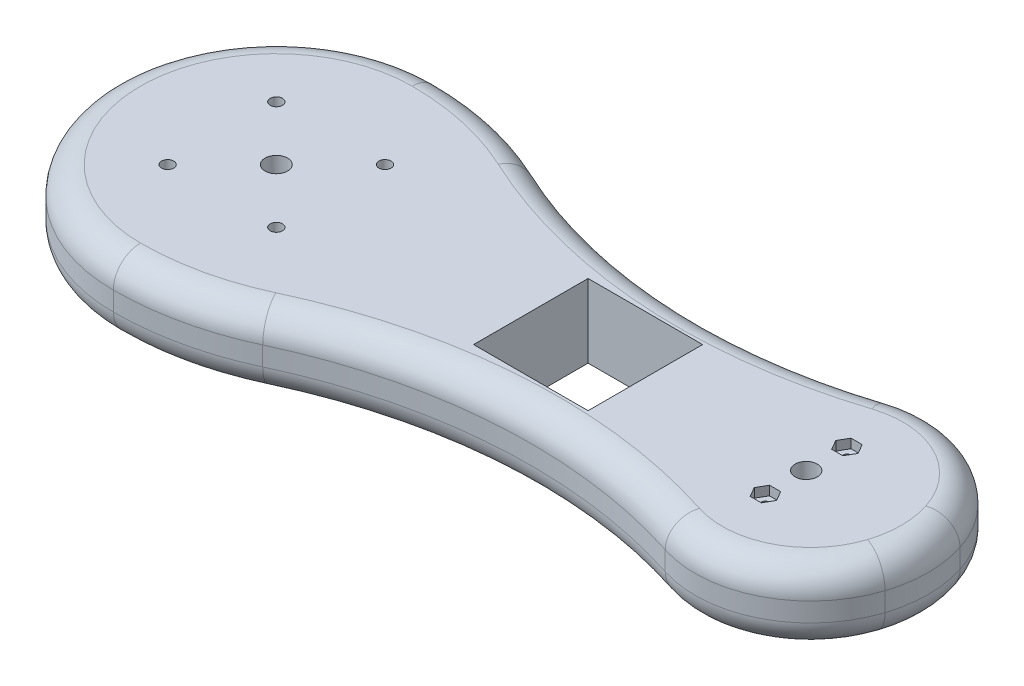
from build123d import *

# Parameters (mm, degrees)
SKETCH1_R               = 2.25
SKETCH1_R_2             = 4.15
SKETCH1_R_3             = 4.09
SKETCH1_R_4             = 1.6
SKETCH1_W               = 42.14
SKETCH1_H               = 42.14
SALIENTE_EXTRUIR1_DEPTH = 27
REDONDEO1_R             = 42.5
REDONDEO2_R             = 10
CORTAR_EXTRUIR1_DEPTH   = 10.2
CORTAR_EXTRUIR2_DEPTH   = 3.39


with BuildPart() as part:
    # Sketch1 → Saliente-Extruir1 (new body)
    with BuildSketch(Plane(origin=(0, 0, 0), x_dir=(1, 0, 0), z_dir=(0, 1, 0))):
        with BuildLine():
            ThreePointArc((0, 60), (-60, 0), (0, -60))
            ThreePointArc((0, -60), (23.048861143, -57.469875145), (45, -50))
            ThreePointArc((45, -50), (119.487995331, -32.139859918), (195, -45))
            ThreePointArc((195, -45), (240, 0), (195, 45))
            ThreePointArc((195, 45), (119.487995331, 32.139859918), (45, 50))
            ThreePointArc((45, 50), (23.048861143, 57.469875145), (0, 60))
        make_face()
        with Locations(Location((-20, -20, 0), (0, 0, 270))):
            Circle(SKETCH1_R, mode=Mode.SUBTRACT)
        with Locations(Location((20, -20, 0), (0, 0, 270))):
            Circle(SKETCH1_R, mode=Mode.SUBTRACT)
        with Locations(Location((-20, 20, 0), (0, 0, 270))):
            Circle(SKETCH1_R, mode=Mode.SUBTRACT)
        with Locations(Location((20, 20, 0), (0, 0, 270))):
            Circle(SKETCH1_R, mode=Mode.SUBTRACT)
        with Locations(Location((0, 0, 0), (0, 0, 270))):
            Circle(SKETCH1_R_2, mode=Mode.SUBTRACT)
        with Locations(Location((195, 0, 0), (0, 0, 270))):
            Circle(SKETCH1_R_3, mode=Mode.SUBTRACT)
        with Locations(Location((195, -15, 0), (0, 0, 270))):
            Circle(SKETCH1_R_4, mode=Mode.SUBTRACT)
        with Locations(Location((195, 15, 0), (0, 0, 270))):
            Circle(SKETCH1_R_4, mode=Mode.SUBTRACT)
        with Locations((114.74, 0)):
            Rectangle(SKETCH1_W, SKETCH1_H, mode=Mode.SUBTRACT)
    extrude(amount=SALIENTE_EXTRUIR1_DEPTH)

    # Redondeo1
    # the kernel refuses this fillet: 42.5 mm, written as the material it takes off along each edge
    with BuildSketch(Plane(origin=(195, -132.493054203, -45), x_dir=(0.8082364962283539, 0, 0.5888580186806613), z_dir=(0, 1, 0))) as redondeo1_piece_1:
        with BuildLine():
            CenterArc((27.970755887, -34.35005109), REDONDEO1_R, 53.923988444, 90)
            ThreePointArc((-6.379295202, -9.323585296), (-3.120659761, -4.708994854), (0, 0))
            ThreePointArc((0, 0), (26.498610841, 8.62935767), (52.997221681, 0))
        make_face()
    extrude(amount=291.986108406, mode=Mode.SUBTRACT)
    with BuildSketch(Plane(origin=(195, -132.493054203, 45), x_dir=(-0.9423869480769151, 0, -0.3345247974280495), z_dir=(0, 1, 0))) as redondeo1_piece_2:
        with BuildLine():
            CenterArc((12.554710632, -42.481389287), REDONDEO1_R, 91.695666833, 90)
            ThreePointArc((-29.926678654, -43.73899188), (-22.085210872, -16.996636462), (0, 0))
            ThreePointArc((0, 0), (5.64855402, -0.083590492), (11.297108039, 0))
        make_face()
    extrude(amount=291.986108406, mode=Mode.SUBTRACT)

    # Redondeo2
    redondeo2_edges = [part.edges().sort_by_distance(p)[0] for p in [
        (23.048861143, 27, 57.469875145),
        (113.845361587, 27, 32.411584628),
        (23.048861143, 27, -57.469875145),
        (240, 0, 0),
        (240, 27, 0),
        (113.845361587, 0, -32.411584628),
        (216.774685632, 0, -38.582680786),
        (216.774685632, 0, 38.582680786),
        (113.845361587, 27, -32.411584628),
        (216.774685632, 27, -38.582680786),
        (216.774685632, 27, 38.582680786),
        (113.845361587, 0, 32.411584628),
        (23.048861143, 0, 57.469875145),
        (-60, 0, 0),
        (23.048861143, 0, -57.469875145),
        (-60, 27, 0),
    ]]
    fillet(redondeo2_edges, radius=REDONDEO2_R)

    # Croquis1 → Cortar-Extruir1 (cut)
    with BuildSketch(Plane.XZ):
        with BuildLine():
            Line((207.7, 17.4), (207.7, -17.4))
            ThreePointArc((207.7, -17.4), (195, -30.1), (182.3, -17.4))
            Line((182.3, -17.4), (182.3, 17.4))
            ThreePointArc((182.3, 17.4), (195, 30.1), (207.7, 17.4))
        make_face()
    extrude(amount=-CORTAR_EXTRUIR1_DEPTH, mode=Mode.SUBTRACT)

    # Croquis2 → Cortar-Extruir2 (cut)
    with BuildSketch(Plane(origin=(0, 27, 0), x_dir=(1, 0, 0), z_dir=(0, 1, 0))):
        Polygon((199.110733917, 15), (197.055366958, 18.56), (192.944633042, 18.56), (190.889266083, 15), (192.944633042, 11.44), (197.055366958, 11.44), align=None)
        Polygon((197.055366958, -11.44), (192.944633042, -11.44), (190.889266083, -15), (192.944633042, -18.56), (197.055366958, -18.56), (199.110733917, -15), align=None)
    extrude(amount=-CORTAR_EXTRUIR2_DEPTH, mode=Mode.SUBTRACT)


solid = part.part
